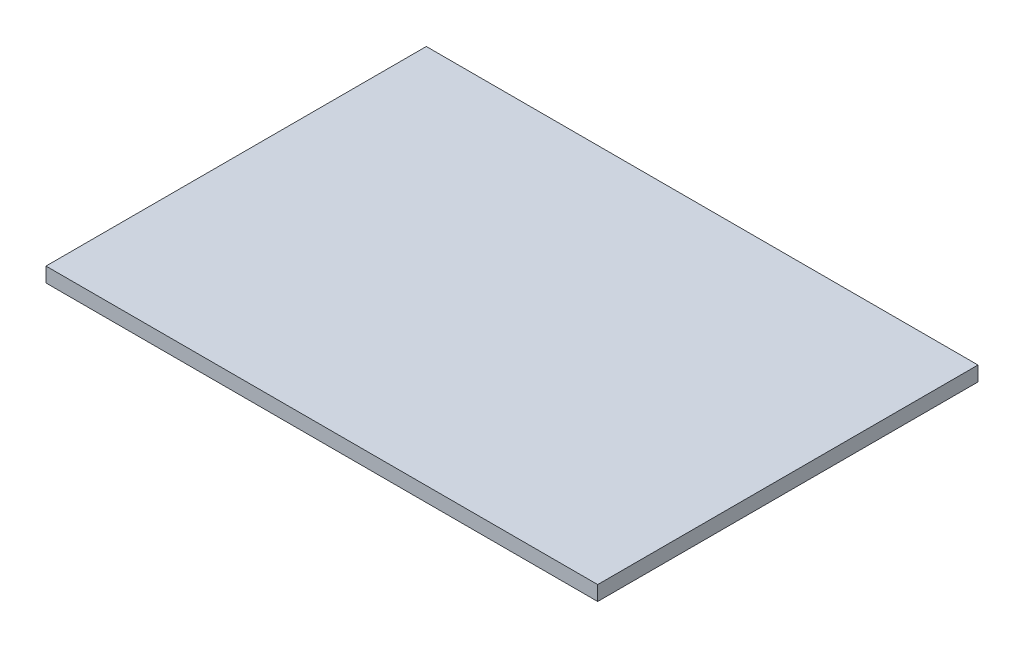
from build123d import *

# Parameters (mm, degrees)
SKETCH1_W           = 338
SKETCH1_H           = 233
BOSS_EXTRUDE1_DEPTH = 9


with BuildPart() as part:
    # Sketch1 → Boss-Extrude1 (new body)
    with BuildSketch(Plane(origin=(0, 0, 0), x_dir=(1, 0, 0), z_dir=(0, 1, 0))):
        Rectangle(SKETCH1_W, SKETCH1_H)
    extrude(amount=BOSS_EXTRUDE1_DEPTH)


solid = part.part
